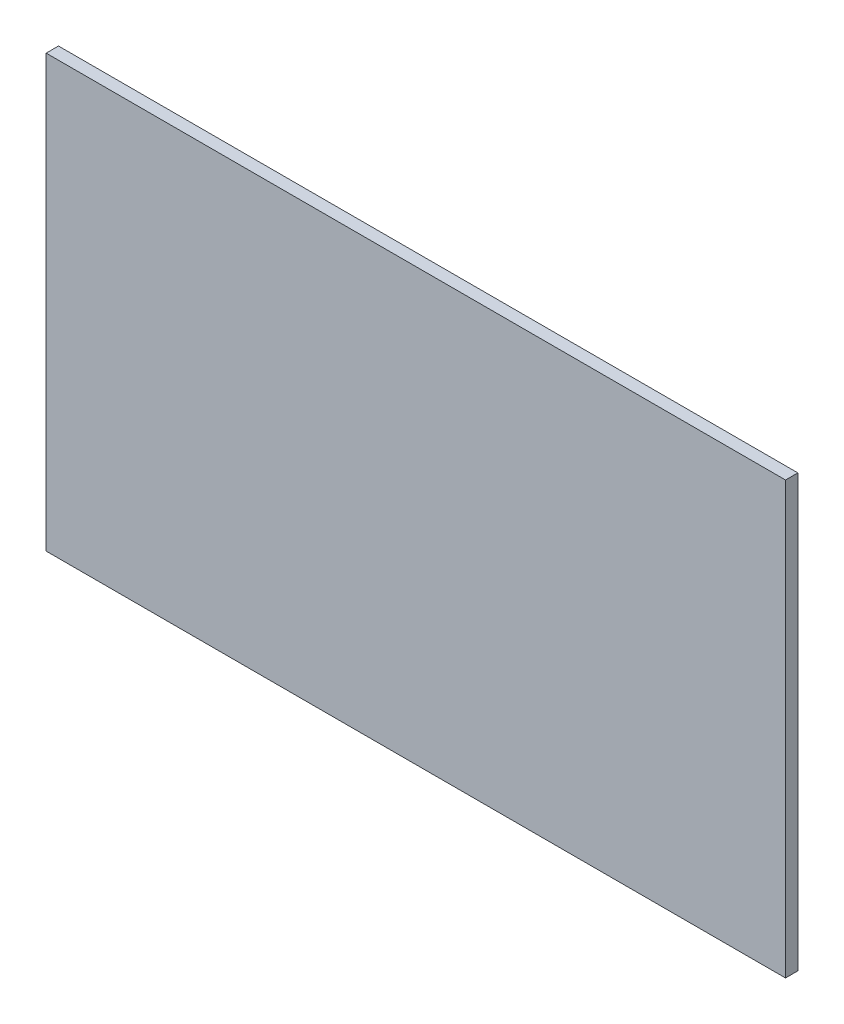
from build123d import *

# Parameters (mm, degrees)
SKETCH_1_W      = 180
SKETCH_1_H      = 105
EXTRUDE_1_DEPTH = 3


with BuildPart() as part:
    # 草图1 → 凸台-拉伸1 (new body)
    with BuildSketch(Plane.XY):
        Rectangle(SKETCH_1_W, SKETCH_1_H)
    extrude(amount=EXTRUDE_1_DEPTH)


solid = part.part
